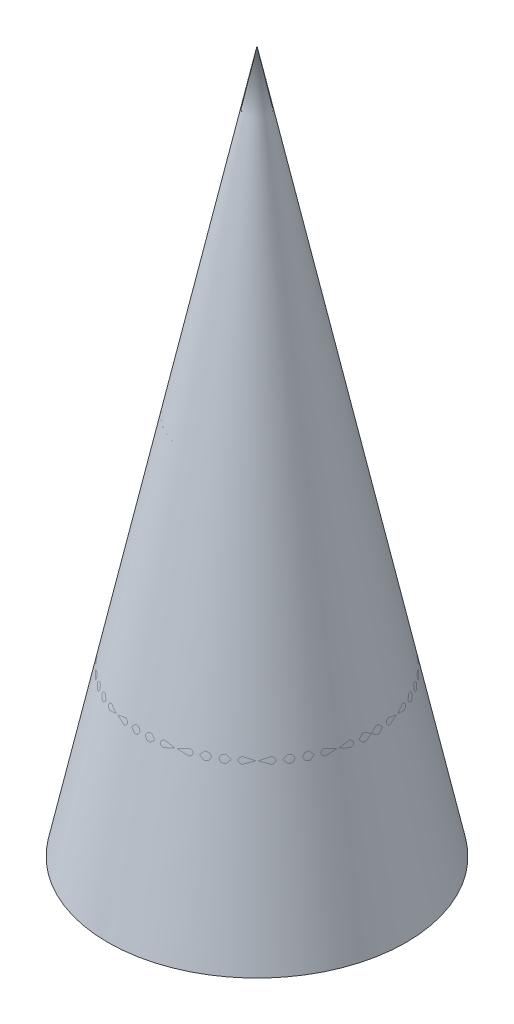
from build123d import *


with BuildPart() as part:
    # 草图1 → 旋转1 (revolve)
    with BuildSketch(Plane.XY):
        Polygon((0, 0), (0, 300), (63.766968501, 0), align=None)
    revolve(axis=Axis((0, 118.33598762, 0), (0, -1, 0)))

    # 草图2 → 切除-旋转1 (revolve, cut)
    with BuildSketch(Plane.XY):
        with BuildLine():
            Line((0, 185.702969658), (0, 125.712969658))
            ThreePointArc((0, 125.712969658), (29.995, 155.707969658), (0, 185.702969658))
        make_face()
        with BuildLine():
            Line((0, 109.508282763), (0, 9.518282763))
            ThreePointArc((0, 9.518282763), (49.995, 59.513282763), (0, 109.508282763))
        make_face()
    revolve(axis=Axis((0, 300, 0), (0, -1, 0)), mode=Mode.SUBTRACT)


solid = part.part
